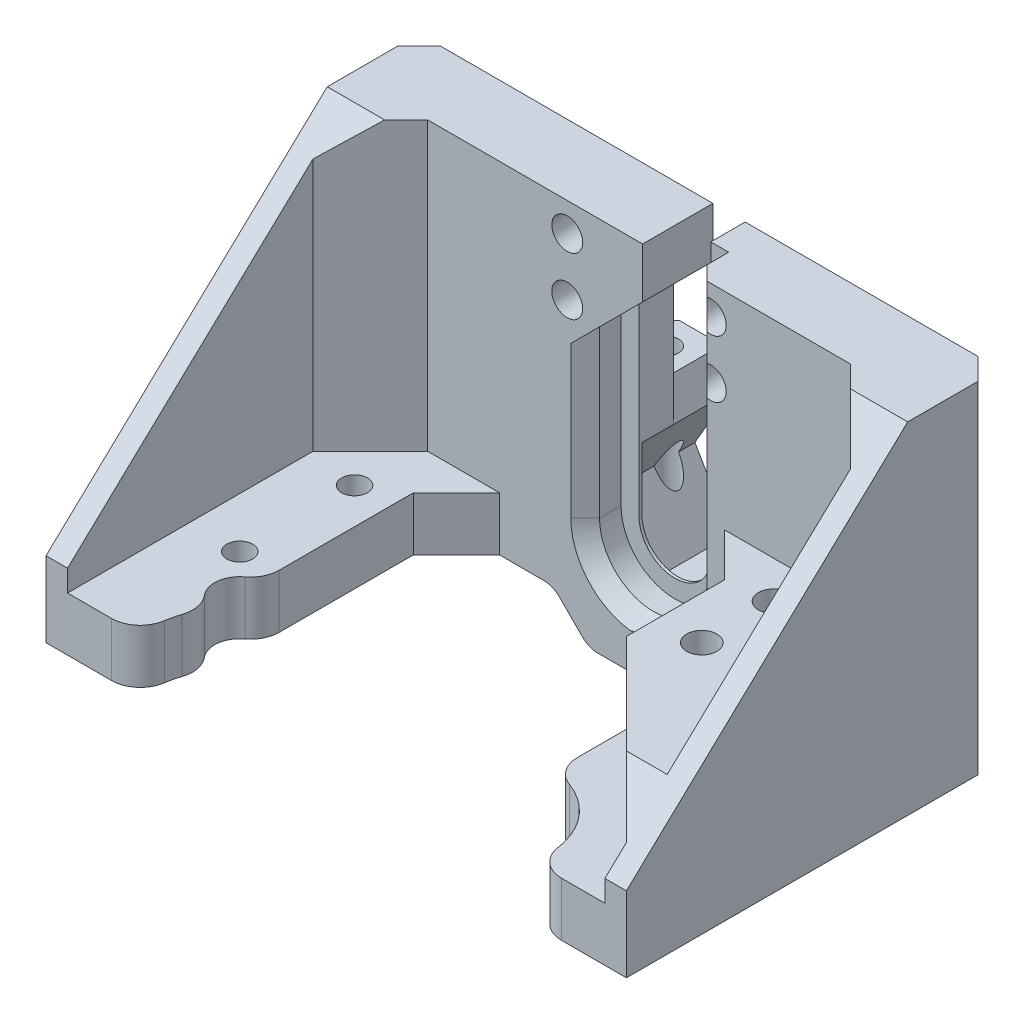
from build123d import *

# Parameters (mm, degrees)
SKETCH1_R                                            = 1
BOSS_EXTRUDE1_DEPTH                                  = 7.5
CSK_FOR_M3_HEX_SOCKET_COUNTERSUNK_HEAD_S_D           = 3.6
CSK_FOR_M3_HEX_SOCKET_COUNTERSUNK_HEAD_S_CSINK_D     = 6.94
CSK_FOR_M3_HEX_SOCKET_COUNTERSUNK_HEAD_S_CSINK_ANGLE = 90
SKETCH4_W                                            = 74.89
SKETCH4_H                                            = 9.8
BOSS_EXTRUDE2_DEPTH                                  = 40
BOSS_EXTRUDE3_DEPTH                                  = 3
BOSS_EXTRUDE4_START                                  = -74.89
BOSS_EXTRUDE4_DEPTH                                  = 3
SKETCH6_R                                            = 10.5
CUT_EXTRUDE1_DEPTH                                   = 92.491213239
FILLET1_R                                            = 4
BOSS_EXTRUDE5_START                                  = 5.2
SKETCH7_W                                            = 19.5
SKETCH7_H                                            = 19.2
BOSS_EXTRUDE5_DEPTH                                  = 6
SKETCH10_W                                           = 2.1
SKETCH10_H                                           = 34.8
F_4_2_4_2_DIAMETER_HOLE1_AT_2_COUNT                  = 2
F_4_2_4_2_DIAMETER_HOLE1_AT_2_PITCH                  = 10
CHAMFER1_SIZE                                        = 20
CHAMFER2_SIZE                                        = 8
CHAMFER3_SIZE                                        = 3
CHAMFER4_SIZE                                        = 6
CUT_EXTRUDE2_DEPTH                                   = 100.928184836
CUT_EXTRUDE3_DEPTH                                   = 5
BOSS_EXTRUDE6_DEPTH                                  = 9.8
BOSS_EXTRUDE8_DEPTH                                  = 8
CUT_EXTRUDE4_DEPTH                                   = 4.4
BOSS_EXTRUDE9_DEPTH                                  = 8
SKETCH17_R                                           = 1
CUT_EXTRUDE5_DEPTH                                   = 92.491213353
M3_CLEARANCE_HOLE1_D                                 = 3.4
CHAMFER9_SIZE                                        = 8
CHAMFER8_SIZE                                        = 2
F_4_3_4_3_DIAMETER_HOLE1_D                           = 4.3
SKETCH24_W                                           = 12
SKETCH24_H                                           = 5
BOSS_EXTRUDE10_DEPTH                                 = 17.8
CHAMFER10_SIZE                                       = 6
SKETCH25_R                                           = 3.75
CUT_EXTRUDE6_DEPTH                                   = 5
FILLET3_R                                            = 3


# Some blends are built 0.0001 mm under size
with BuildPart() as part:
    # Sketch1 → Boss-Extrude1 (new body)
    with BuildSketch(Plane(origin=(0, 0, 0), x_dir=(1, 0, 0), z_dir=(0, 1, 0))):
        Polygon((48.39, 9.2), (48.39, -33), (67.89, -33), (67.89, 19), (-7, 19), (-7, -33), (5, -33), (5, 9.2), align=None)
        with Locations(Location((0, 0, 0), (0, 0, 270))):
            Circle(SKETCH1_R, mode=Mode.SUBTRACT)
        with Locations(Location((0, -16, 0), (0, 0, 270))):
            Circle(SKETCH1_R, mode=Mode.SUBTRACT)
        with Locations(Location((54.39, 4, 0), (0, 0, 270))):
            Circle(SKETCH1_R, mode=Mode.SUBTRACT)
        with Locations(Location((54.39, -6, 0), (0, 0, 270))):
            Circle(SKETCH1_R, mode=Mode.SUBTRACT)
    extrude(amount=BOSS_EXTRUDE1_DEPTH)

    # CSK for M3 Hex Socket Countersunk Head Screw1 (through all)
    with Locations(Plane(origin=(0, 0, 0), x_dir=(-1, 0, 0), z_dir=(0, -1, 0))):
        with Locations((0, 0), (0, -16), (-54.39, 4), (-54.39, -6)):
            CounterSinkHole(CSK_FOR_M3_HEX_SOCKET_COUNTERSUNK_HEAD_S_D / 2, CSK_FOR_M3_HEX_SOCKET_COUNTERSUNK_HEAD_S_CSINK_D / 2, counter_sink_angle=CSK_FOR_M3_HEX_SOCKET_COUNTERSUNK_HEAD_S_CSINK_ANGLE)

    # Sketch4 → Boss-Extrude2 (add)
    with BuildSketch(Plane(origin=(0, 7.5, 0), x_dir=(1, 0, 0), z_dir=(0, 1, 0))):
        with Locations((30.445, 14.1)):
            Rectangle(SKETCH4_W, SKETCH4_H)
    extrude(amount=BOSS_EXTRUDE2_DEPTH)

    # Sketch5 → Boss-Extrude3 (add)
    with BuildSketch(Plane.ZY.offset(7)):
        Polygon((-19, 47.5), (-6.2, 47.5), (33, 10.5), (33, 0), (-19, 0), align=None)
    extrude(amount=BOSS_EXTRUDE3_DEPTH)

    # Sketch5<2> → Boss-Extrude4 (add)
    with BuildSketch(Plane.ZY.offset(7).offset(BOSS_EXTRUDE4_START)):
        Polygon((-19, 47.5), (-6.2, 47.5), (33, 10.5), (33, 0), (-19, 0), align=None)
    extrude(amount=-BOSS_EXTRUDE4_DEPTH)

    # Sketch6 → Cut-Extrude1 (cut, through all)
    with BuildSketch(Plane.XZ):
        with BuildLine():
            Line((3, 33), (3, 31))
            ThreePointArc((3, 31), (3.490813002, 27.827276305), (4.917366789, 24.951164809))
            ThreePointArc((4.917366789, 24.951164809), (4.958644749, 24.957880058), (5, 24.964101615))
            Line((5, 24.964101615), (5, 33))
            Line((5, 33), (3, 33))
        make_face()
        with BuildLine():
            ThreePointArc((5, 24.964101615), (4.958644749, 24.957880058), (4.917366789, 24.951164809))
            ThreePointArc((4.917366789, 24.951164809), (4.958487899, 24.893235633), (5, 24.835585997))
            Line((5, 24.835585997), (5, 24.964101615))
        make_face()
        with BuildLine():
            ThreePointArc((5, 24.835585997), (4.958487899, 24.893235633), (4.917366789, 24.951164809))
            ThreePointArc((4.917366789, 24.951164809), (2.000249852, 21.458180123), (5, 18.035898385))
            Line((5, 18.035898385), (5, 24.835585997))
        make_face()
        with Locations((47.5, 31)):
            Circle(SKETCH6_R)
    extrude(amount=-CUT_EXTRUDE1_DEPTH, mode=Mode.SUBTRACT)

    # Fillet1
    fillet1_edges = [part.edges().sort_by_distance(p)[0] for p in [
        (3, 3.75, 33),
        (4.917366789, 3.75, 24.951164809),
        (5, 3.75, 18.035898385),
        (57.807764064, 3.75, 33),
        (48.39, 3.75, 20.537787041),
    ]]
    fillet(fillet1_edges, radius=FILLET1_R)

    # Sketch7 → Boss-Extrude5 (add)
    with BuildSketch(Plane(origin=(0, 7.5, 0), x_dir=(1, 0, 0), z_dir=(0, 1, 0)).offset(BOSS_EXTRUDE5_START)):
        with Locations((58.14, -0.4)):
            Rectangle(SKETCH7_W, SKETCH7_H)
    extrude(amount=BOSS_EXTRUDE5_DEPTH)

    # Sketch10 → Ø4.2 (4.2) Diameter Hole1 (revolve, cut)
    with BuildSketch(Plane(origin=(54.39, 12.7, 6), x_dir=(0, 0, -1), z_dir=(1, 0, 0))):
        with Locations((1.05, 17.4)):
            Rectangle(SKETCH10_W, SKETCH10_H)
    f_4_2_4_2_diameter_hole1 = revolve(axis=Axis((54.39, 6.35, 6), (0, 1, 0)), mode=Mode.SUBTRACT)

    # Ø4.2 (4.2) Diameter Hole1 at 2: Ø4.2 (4.2) Diameter Hole1 ×2
    with Locations(*[(0, 0, -i * F_4_2_4_2_DIAMETER_HOLE1_AT_2_PITCH) for i in range(1, F_4_2_4_2_DIAMETER_HOLE1_AT_2_COUNT)]):
        add(f_4_2_4_2_diameter_hole1, mode=Mode.SUBTRACT)

    # Chamfer1
    # the kernel refuses this chamfer: 20 mm, written as the material it adds along each edge
    with BuildSketch(Plane(origin=(67.89, 12.7, 10), x_dir=(0.027495876610586317, 0, 0.9996219169112968), z_dir=(0, 1, 0))) as chamfer1_piece_1_section:
        Polygon((CHAMFER1_SIZE * 0.999621916911, -CHAMFER1_SIZE * 0.0274958766106), (-CHAMFER1_SIZE * 0.0274958766106, -CHAMFER1_SIZE * 0.999621916911), (0, 0), align=None)
    chamfer1_piece_1 = extrude(amount=6, mode=Mode.PRIVATE)
    chamfer1_piece_1 = split(chamfer1_piece_1, bisect_by=Plane(origin=(61.158483733, 21.28565178, 21.573039195), z_dir=(0, -0.7272189114449651, -0.6864056051904006)), keep=Keep.TOP, mode=Mode.PRIVATE)
    chamfer1_piece_1 = split(chamfer1_piece_1, bisect_by=Plane(origin=(48.39, 15.651248757, 16.254852669), z_dir=(1, 0, 0)), keep=Keep.TOP, mode=Mode.PRIVATE)
    add(chamfer1_piece_1)

    # Chamfer2
    chamfer2_edges = [part.edges().sort_by_distance(p)[0] for p in [
        (-7, 27.5, -9.2),
        (67.89, 33.1, -9.2),
    ]]
    chamfer(chamfer2_edges, length=CHAMFER2_SIZE)

    # Chamfer3
    chamfer3_edges = [part.edges().sort_by_distance(p)[0] for p in [
        (70.89, 23.75, -19),
        (-10, 23.75, -19),
    ]]
    chamfer(chamfer3_edges, length=CHAMFER3_SIZE)

    # Chamfer4
    chamfer4_edges = [part.edges().sort_by_distance(p)[0] for p in [
        (5, 3.75, -9.2),
        (48.39, 3.75, -9.2),
        (48.39, 15.7, -9.2),
    ]]
    chamfer(chamfer4_edges, length=CHAMFER4_SIZE)

    # Sketch11 → Cut-Extrude2 (cut, through all)
    with BuildSketch(Plane(origin=(0, 0, -19), x_dir=(-1, 0, 0), z_dir=(0, 0, -1))):
        with BuildLine():
            Line((-35.445, 9.4), (-35.445, 47.5))
            Line((-35.445, 47.5), (-25.445, 47.5))
            Line((-25.445, 47.5), (-25.445, 9.4))
            ThreePointArc((-25.445, 9.4), (-30.445, 4.4), (-35.445, 9.4))
        make_face()
    extrude(amount=-CUT_EXTRUDE2_DEPTH, mode=Mode.SUBTRACT)

    # Sketch14 → Cut-Extrude3 (cut)
    with BuildSketch(Plane.XY.offset(-9.2)):
        with BuildLine():
            Line((22.945, 9.4), (22.945, 47.5))
            Line((22.945, 47.5), (37.945, 47.5))
            Line((37.945, 47.5), (37.945, 9.4))
            ThreePointArc((37.945, 9.4), (30.445, 1.9), (22.945, 9.4))
        make_face()
    extrude(amount=-CUT_EXTRUDE3_DEPTH, mode=Mode.SUBTRACT)

    # Sketch12 → Boss-Extrude6 (add)
    with BuildSketch(Plane(origin=(0, 0, -9.2), x_dir=(-1, 0, 0), z_dir=(0, 0, -1))):
        Polygon((-22.945, 47.5), (-30.945, 47.5), (-30.945, 40.5), (-22.945, 32.5), align=None)
    extrude(amount=BOSS_EXTRUDE6_DEPTH)

    # Sketch15 → Boss-Extrude8 (add)
    with BuildSketch(Plane(origin=(0, 0, -19), x_dir=(-1, 0, 0), z_dir=(0, 0, -1))):
        with BuildLine():
            Line((-42.134311357, 0), (-18.755688643, 0))
            ThreePointArc((-18.755688643, 0), (-15.846445905, 12.847059375), (-24.195, 23.035890143))
            Line((-24.195, 23.035890143), (-25.445, 18.060254038))
            Line((-25.445, 18.060254038), (-20.445, 9.4))
            Line((-20.445, 9.4), (-25.445, 0.739745962))
            Line((-25.445, 0.739745962), (-35.445, 0.739745962))
            Line((-35.445, 0.739745962), (-40.445, 9.4))
            Line((-40.445, 9.4), (-35.445, 18.060254038))
            Line((-35.445, 18.060254038), (-36.695, 23.035890143))
            ThreePointArc((-36.695, 23.035890143), (-45.043554095, 12.847059375), (-42.134311357, 0))
        make_face()
    extrude(amount=BOSS_EXTRUDE8_DEPTH)

    # Sketch16 → Cut-Extrude4 (cut)
    with BuildSketch(Plane(origin=(0, 0, -19), x_dir=(-1, 0, 0), z_dir=(0, 0, -1))):
        with BuildLine():
            Line((-25.445, 0.739745962), (-20.445, 9.4))
            Line((-20.445, 9.4), (-25.445, 18.060254038))
            Line((-25.445, 18.060254038), (-25.445, 9.4))
            ThreePointArc((-25.445, 9.4), (-30.445, 4.4), (-35.445, 9.4))
            Line((-35.445, 9.4), (-35.445, 18.060254038))
            Line((-35.445, 18.060254038), (-40.445, 9.4))
            Line((-40.445, 9.4), (-35.445, 0.739745962))
            Line((-35.445, 0.739745962), (-25.445, 0.739745962))
        make_face()
    extrude(amount=-CUT_EXTRUDE4_DEPTH, mode=Mode.SUBTRACT)

    # Sketch18 → Boss-Extrude9 (add)
    with BuildSketch(Plane(origin=(0, 0, -19), x_dir=(-1, 0, 0), z_dir=(0, 0, -1))):
        with BuildLine():
            Line((-45.445, 9.4), (-45.445, 0))
            Line((-45.445, 0), (-42.134311357, 0))
            ThreePointArc((-42.134311357, 0), (-44.59313893, 4.41701246), (-45.445, 9.4))
        make_face()
        with BuildLine():
            Line((-18.755688643, 0), (-15.445, 0))
            Line((-15.445, 0), (-15.445, 9.4))
            ThreePointArc((-15.445, 9.4), (-16.29686107, 4.41701246), (-18.755688643, 0))
        make_face()
        with BuildLine():
            ThreePointArc((-24.195, 23.035890143), (-17.820618827, 17.500925873), (-15.445, 9.4))
            Line((-15.445, 9.4), (-15.445, 23.035890143))
            Line((-15.445, 23.035890143), (-24.195, 23.035890143))
        make_face()
        with BuildLine():
            Line((-45.445, 23.035890143), (-45.445, 9.4))
            ThreePointArc((-45.445, 9.4), (-43.069381173, 17.500925873), (-36.695, 23.035890143))
            Line((-36.695, 23.035890143), (-45.445, 23.035890143))
        make_face()
    extrude(amount=BOSS_EXTRUDE9_DEPTH)

    # Sketch17 → Cut-Extrude5 (cut, through all)
    with BuildSketch(Plane.XZ):
        with Locations(Location((20.445, -23, 0), (0, 0, 270))):
            Circle(SKETCH17_R)
        with Locations(Location((40.445, -23, 0), (0, 0, 90))):
            Circle(SKETCH17_R)
    extrude(amount=-CUT_EXTRUDE5_DEPTH, mode=Mode.SUBTRACT)

    # M3 Clearance Hole1 (through all)
    with Locations(Plane(origin=(0, 0, 0), x_dir=(-1, 0, 0), z_dir=(0, -1, 0))):
        with Locations((-20.445, 23), (-40.445, 23)):
            Hole(M3_CLEARANCE_HOLE1_D / 2)

    # Chamfer9
    chamfer9_edges = [part.edges().sort_by_distance(p)[0] for p in [
        (45.445, 11.517945072, -19),
        (15.445, 11.517945072, -19),
    ]]
    chamfer(chamfer9_edges, length=CHAMFER9_SIZE - 0.0001)  # a hair under: the kernel refuses the full size

    # Chamfer7
    # the kernel refuses this chamfer: 2 mm, written as the material it takes off along each edge
    with BuildSketch(Plane(origin=(57.08180896, 23.035890143, -15.36309104), x_dir=(-0.7068394360706733, 0.027495876610585647, 0.7068394360706738), z_dir=(-0.7071067811865477, 0, -0.7071067811865474))) as chamfer7_piece_1_section:
        with BuildLine():
            Line((2.05734639, 0), (-0.11309431, -2.054235587))
            Line((-0.11309431, -2.054235587), (-0.153079186, -2.053135752))
            ThreePointArc((-0.153079186, -2.053135752), (-0.068258454, -1.026795659), (-0.039984877, 0.001099835))
            Line((-0.039984877, 0.001099835), (0.001099835, 0.039984877))
            ThreePointArc((0.001099835, 0.039984877), (1.028995329, 0.011711299), (2.058446225, 0.039984877))
            Line((2.058446225, 0.039984877), (2.05734639, 0))
        make_face()
    chamfer7_piece_1 = extrude(amount=21.600299029, mode=Mode.PRIVATE)
    chamfer7_piece_1 = split(chamfer7_piece_1, bisect_by=Plane(origin=(49.014493998, 22.349128666, -19), z_dir=(0, 0, -1)), keep=Keep.TOP, mode=Mode.PRIVATE)
    add(chamfer7_piece_1, mode=Mode.SUBTRACT)
    with BuildSketch(Plane(origin=(57.08180896, 0, -15.36309104), x_dir=(-0.7068394360706733, -0.027495876610586473, 0.7068394360706738), z_dir=(-0.7071067811865477, 0, -0.7071067811865474))) as chamfer7_piece_2_section:
        with BuildLine():
            Line((2.05734639, 0), (-0.11309431, 2.054235587))
            Line((-0.11309431, 2.054235587), (-0.153079186, 2.053135752))
            ThreePointArc((-0.153079186, 2.053135752), (-0.068258454, 1.026795659), (-0.039984877, -0.001099835))
            Line((-0.039984877, -0.001099835), (0.001099835, -0.039984877))
            ThreePointArc((0.001099835, -0.039984877), (1.028995329, -0.011711299), (2.058446225, -0.039984877))
            Line((2.058446225, -0.039984877), (2.05734639, 0))
        make_face()
    chamfer7_piece_2 = extrude(amount=21.600299029, mode=Mode.PRIVATE)
    chamfer7_piece_2 = split(chamfer7_piece_2, bisect_by=Plane(origin=(49.014493998, 0.686761477, -19), z_dir=(0, 0, -1)), keep=Keep.TOP, mode=Mode.PRIVATE)
    add(chamfer7_piece_2, mode=Mode.SUBTRACT)
    with BuildSketch(Plane(origin=(19.08190896, 23.035890143, -30.63680896), x_dir=(0.7068394360706736, 0.0274958766105856, 0.7068394360706736), z_dir=(-0.7071067811865476, 0, 0.7071067811865476))) as chamfer7_piece_3_section:
        with BuildLine():
            Line((2.05734639, 0), (-0.11309431, -2.054235587))
            Line((-0.11309431, -2.054235587), (-0.153079186, -2.053135752))
            ThreePointArc((-0.153079186, -2.053135752), (-0.068258454, -1.026795659), (-0.039984877, 0.001099835))
            Line((-0.039984877, 0.001099835), (0.001099835, 0.039984877))
            ThreePointArc((0.001099835, 0.039984877), (1.028995329, 0.011711299), (2.058446225, 0.039984877))
            Line((2.058446225, 0.039984877), (2.05734639, 0))
        make_face()
    chamfer7_piece_3 = extrude(amount=21.600299029, mode=Mode.PRIVATE)
    chamfer7_piece_3 = split(chamfer7_piece_3, bisect_by=Plane(origin=(17.51212973, 22.399703893, -19), z_dir=(0, 0, -1)), keep=Keep.TOP, mode=Mode.PRIVATE)
    add(chamfer7_piece_3, mode=Mode.SUBTRACT)
    with BuildSketch(Plane(origin=(19.08190896, 0, -30.63680896), x_dir=(0.7068394360706735, -0.02749587661058643, 0.7068394360706735), z_dir=(-0.7071067811865476, 0, 0.7071067811865476))) as chamfer7_piece_4_section:
        with BuildLine():
            Line((2.05734639, 0), (-0.11309431, 2.054235587))
            Line((-0.11309431, 2.054235587), (-0.153079186, 2.053135752))
            ThreePointArc((-0.153079186, 2.053135752), (-0.068258454, 1.026795659), (-0.039984877, -0.001099835))
            Line((-0.039984877, -0.001099835), (0.001099835, -0.039984877))
            ThreePointArc((0.001099835, -0.039984877), (1.028995329, -0.011711299), (2.058446225, -0.039984877))
            Line((2.058446225, -0.039984877), (2.05734639, 0))
        make_face()
    chamfer7_piece_4 = extrude(amount=21.600299029, mode=Mode.PRIVATE)
    chamfer7_piece_4 = split(chamfer7_piece_4, bisect_by=Plane(origin=(17.51212973, 0.63618625, -19), z_dir=(0, 0, -1)), keep=Keep.TOP, mode=Mode.PRIVATE)
    add(chamfer7_piece_4, mode=Mode.SUBTRACT)

    # Chamfer8
    # the kernel refuses this chamfer: 2 mm, written as the material it takes off along each edge
    with BuildSketch(Plane(origin=(30.445, 9.4, -9.2), x_dir=(1, 0, 0), z_dir=(0, 1, 0))) as chamfer8_piece_1:
        Polygon((7.5, CHAMFER8_SIZE), (7.5 + CHAMFER8_SIZE, 0), (7.5, 0), align=None)
    revolve(axis=Axis((30.445, 9.4, -9.2), (0, 0, -1)), revolution_arc=180, mode=Mode.SUBTRACT)
    with BuildSketch(Plane(origin=(37.945, 52.643365976, -9.2), x_dir=(-0.027495876610585623, 0, -0.9996219169112968), z_dir=(0, -1, 0))) as chamfer8_piece_2:
        Polygon((CHAMFER8_SIZE * 0.999621916911, CHAMFER8_SIZE * 0.0274958766106), (-CHAMFER8_SIZE * 0.0274958766106, CHAMFER8_SIZE * 0.999621916911), (0, 0), align=None)
    extrude(amount=43.243365976, mode=Mode.SUBTRACT)
    with BuildSketch(Plane(origin=(22.945, 9.4, -9.2), x_dir=(0.027495876610585623, 0, -0.9996219169112968), z_dir=(0, 1, 0))) as chamfer8_piece_3_section:
        Polygon((CHAMFER8_SIZE * 0.999621916911, CHAMFER8_SIZE * 0.0274958766106), (-CHAMFER8_SIZE * 0.0274958766106, CHAMFER8_SIZE * 0.999621916911), (0, 0), align=None)
    chamfer8_piece_3 = extrude(amount=28.243365976, mode=Mode.PRIVATE)
    chamfer8_piece_3 = split(chamfer8_piece_3, bisect_by=Plane(origin=(16.683799048, 26.238799048, -9.86563861), z_dir=(0.7071067811865517, -0.7071067811865435, 0)), keep=Keep.TOP, mode=Mode.PRIVATE)
    add(chamfer8_piece_3, mode=Mode.SUBTRACT)

    # Ø4.3 (4.3) Diameter Hole1 (through all)
    with Locations(Plane(origin=(0, 0, -19), x_dir=(-1, 0, 0), z_dir=(0, 0, -1))):
        with Locations((-20.445, 43.5), (-40.445, 43.5), (-40.445, 35.5), (-20.445, 35.5)):
            Hole(F_4_3_4_3_DIAMETER_HOLE1_D / 2)

    # Sketch24 → Boss-Extrude10 (add)
    with BuildSketch(Plane(origin=(0, 0, -27), x_dir=(-1, 0, 0), z_dir=(0, 0, -1))):
        with Locations((-30.445, -2.5)):
            Rectangle(SKETCH24_W, SKETCH24_H)
    extrude(amount=-BOSS_EXTRUDE10_DEPTH)

    # Chamfer10
    # the kernel refuses this chamfer: 6 mm, written as the material it adds along each edge
    with BuildSketch(Plane(origin=(24.445, 0, -27), x_dir=(-0.9996219169112969, 0.027495876610586382, 0), z_dir=(0, 0, 1))) as chamfer10_piece_1_section:
        Polygon((CHAMFER10_SIZE * 0.999621916911, CHAMFER10_SIZE * 0.0274958766106), (-CHAMFER10_SIZE * 0.0274958766106, CHAMFER10_SIZE * 0.999621916911), (0, 0), align=None)
    chamfer10_piece_1 = extrude(amount=17.8, mode=Mode.PRIVATE)
    chamfer10_piece_1 = split(chamfer10_piece_1, bisect_by=Plane(origin=(22.4928011, -5, -17.799111782), z_dir=(0, 1, 0)), keep=Keep.TOP, mode=Mode.PRIVATE)
    chamfer10_piece_1 = chamfer10_piece_1 - Plane(origin=(20.445, -1.885016642, -23), x_dir=(1, 0, 0), z_dir=(0, 1, 0)) * Cylinder(1.7, 60, mode=Mode.PRIVATE)
    add(chamfer10_piece_1)
    with BuildSketch(Plane(origin=(36.445, 0, -27), x_dir=(0.9996219169112968, 0.027495876610586115, 0), z_dir=(0, 0, 1))) as chamfer10_piece_2_section:
        Polygon((CHAMFER10_SIZE * 0.999621916911, -CHAMFER10_SIZE * 0.0274958766106), (-CHAMFER10_SIZE * 0.0274958766106, -CHAMFER10_SIZE * 0.999621916911), (0, 0), align=None)
    chamfer10_piece_2 = extrude(amount=17.8, mode=Mode.PRIVATE)
    chamfer10_piece_2 = split(chamfer10_piece_2, bisect_by=Plane(origin=(35.20353905, -1.820831898, -16.38646095), z_dir=(0.7071067811865476, 0, -0.7071067811865476)), keep=Keep.TOP, mode=Mode.PRIVATE)
    chamfer10_piece_2 = chamfer10_piece_2 - Plane(origin=(40.445, -1.820831898, -23), x_dir=(1, 0, 0), z_dir=(0, 1, 0)) * Cylinder(1.7, 60, mode=Mode.PRIVATE)
    chamfer10_piece_2 = split(chamfer10_piece_2, bisect_by=Plane(origin=(38.540643339, -5, -19.723565238), z_dir=(0, 1, 0)), keep=Keep.TOP, mode=Mode.PRIVATE)
    add(chamfer10_piece_2)
    with BuildSketch(Plane(origin=(36.445, 0, -27), x_dir=(0.9996219169112968, 0.027495876610586115, 0), z_dir=(0, 0, 1))) as chamfer10_piece_3_section:
        Polygon((CHAMFER10_SIZE * 0.999621916911, -CHAMFER10_SIZE * 0.0274958766106), (-CHAMFER10_SIZE * 0.0274958766106, -CHAMFER10_SIZE * 0.999621916911), (0, 0), align=None)
    chamfer10_piece_3 = extrude(amount=17.8, mode=Mode.PRIVATE)
    chamfer10_piece_3 = split(chamfer10_piece_3, bisect_by=Plane(origin=(39.039551122, -2.097320223, -12.550448878), z_dir=(-0.7071067811865476, 0, 0.7071067811865476)), keep=Keep.TOP, mode=Mode.PRIVATE)
    chamfer10_piece_3 = split(chamfer10_piece_3, bisect_by=Plane(origin=(37.922734829, -5, -11.433632585), z_dir=(0, 1, 0)), keep=Keep.TOP, mode=Mode.PRIVATE)
    add(chamfer10_piece_3)
    with BuildSketch(Plane(origin=(36.445, 0, -27), x_dir=(0.9996219169112968, 0.027495876610586115, 0), z_dir=(0, 0, 1))) as chamfer10_piece_4_section:
        Polygon((CHAMFER10_SIZE * 0.999621916911, -CHAMFER10_SIZE * 0.0274958766106), (-CHAMFER10_SIZE * 0.0274958766106, -CHAMFER10_SIZE * 0.999621916911), (0, 0), align=None)
    chamfer10_piece_4 = extrude(amount=33.230097928, mode=Mode.PRIVATE)
    chamfer10_piece_4 = split(chamfer10_piece_4, bisect_by=Plane(origin=(42.492111727, 0.181816824, -9.097888273), z_dir=(0.7071067811865476, 0, -0.7071067811865476)), keep=Keep.TOP, mode=Mode.PRIVATE)
    chamfer10_piece_4 = split(chamfer10_piece_4, bisect_by=Plane(origin=(42.526148969, 0.181816824, -9.2), z_dir=(0, 0, 1)), keep=Keep.TOP, mode=Mode.PRIVATE)
    add(chamfer10_piece_4)

    # Sketch25 → Cut-Extrude6 (cut)
    with BuildSketch(Plane.XZ.offset(5)):
        with Locations((40.445, -23)):
            Circle(SKETCH25_R)
        with Locations((20.445, -23)):
            Circle(SKETCH25_R)
    extrude(amount=-CUT_EXTRUDE6_DEPTH, mode=Mode.SUBTRACT)

    # Fillet3
    # the kernel refuses this fillet: 3 mm, written as the material it adds along each edge
    with BuildSketch(Plane(origin=(42.445, 0, -22.934457333), x_dir=(-0.7071067811862632, -0.7071067811868319, 0), z_dir=(0, 0, 1))) as fillet3_piece_1_section:
        with BuildLine():
            CenterArc((FILLET3_R * 0.414213562373, FILLET3_R), FILLET3_R, 225, 45)
            Line((-FILLET3_R * 0.292893218813, FILLET3_R * 0.292893218814), (0, 0))
            Line((0, 0), (FILLET3_R * 0.414213562373, 0))
        make_face()
    fillet3_piece_1 = extrude(amount=16.89605905, mode=Mode.PRIVATE)
    fillet3_piece_1 = split(fillet3_piece_1, bisect_by=Plane(origin=(39.748763277, -0.175443117, -11.841236723), z_dir=(0.7071067811865476, 0, -0.7071067811865476)), keep=Keep.TOP, mode=Mode.PRIVATE)
    fillet3_piece_1 = fillet3_piece_1 - Plane(origin=(40.445, -0.175443117, -23), x_dir=(1, 0, 0), z_dir=(0, -1, 0)) * Cylinder(3.75, 39, mode=Mode.PRIVATE)
    fillet3_piece_1 = split(fillet3_piece_1, bisect_by=Plane(origin=(42.545702362, -0.175443117, -9.2), z_dir=(0, 0, -1)), keep=Keep.TOP, mode=Mode.PRIVATE)
    add(fillet3_piece_1)
    with BuildSketch(Plane(origin=(42.445, 0, -22.934457333), x_dir=(-0.7071067811862632, -0.7071067811868319, 0), z_dir=(0, 0, 1))) as fillet3_piece_2_section:
        with BuildLine():
            CenterArc((FILLET3_R * 0.414213562373, FILLET3_R), FILLET3_R, 225, 45)
            Line((-FILLET3_R * 0.292893218813, FILLET3_R * 0.292893218814), (0, 0))
            Line((0, 0), (FILLET3_R * 0.414213562373, 0))
        make_face()
    fillet3_piece_2 = extrude(amount=16.89605905, mode=Mode.PRIVATE)
    fillet3_piece_2 = split(fillet3_piece_2, bisect_by=Plane(origin=(42.922925552, -0.008986559, -8.667074448), z_dir=(0.7071067811865476, 0, -0.7071067811865476)), keep=Keep.TOP, mode=Mode.PRIVATE)
    fillet3_piece_2 = split(fillet3_piece_2, bisect_by=Plane(origin=(43.100567402, -0.008986559, -9.2), z_dir=(0, 0, 1)), keep=Keep.TOP, mode=Mode.PRIVATE)
    add(fillet3_piece_2)
    with BuildSketch(Plane(origin=(42.445, 0, -22.934457333), x_dir=(-0.7071067811862632, -0.7071067811868319, 0), z_dir=(0, 0, 1))) as fillet3_piece_3_section:
        with BuildLine():
            CenterArc((FILLET3_R * 0.414213562373, FILLET3_R), FILLET3_R, 225, 45)
            Line((-FILLET3_R * 0.292893218813, FILLET3_R * 0.292893218814), (0, 0))
            Line((0, 0), (FILLET3_R * 0.414213562373, 0))
        make_face()
    fillet3_piece_3 = extrude(amount=16.89605905, mode=Mode.PRIVATE)
    fillet3_piece_3 = split(fillet3_piece_3, bisect_by=Plane(origin=(42.023275547, -0.531665064, -9.566724453), z_dir=(-0.7071067811865476, 0, 0.7071067811865476)), keep=Keep.TOP, mode=Mode.PRIVATE)
    fillet3_piece_3 = split(fillet3_piece_3, bisect_by=Plane(origin=(41.901034062, -0.531665064, -9.2), z_dir=(0, 0, -1)), keep=Keep.TOP, mode=Mode.PRIVATE)
    add(fillet3_piece_3)
    with BuildSketch(Plane(origin=(18.445, 0, -22.934457333), x_dir=(-1, 0, 0), z_dir=(0, 0, 1))) as fillet3_piece_4_section:
        with BuildLine():
            CenterArc((FILLET3_R * 0.414213562373, FILLET3_R), FILLET3_R, 225, 45)
            Line((-FILLET3_R * 0.292893218814, FILLET3_R * 0.292893218814), (0, 0))
            Line((0, 0), (FILLET3_R * 0.414213562373, 0))
        make_face()
    fillet3_piece_4 = extrude(amount=13.734457333, mode=Mode.PRIVATE)
    fillet3_piece_4 = fillet3_piece_4 - Plane(origin=(20.445, -0.179809013, -23), x_dir=(1, 0, 0), z_dir=(0, -1, 0)) * Cylinder(3.75, 33, mode=Mode.PRIVATE)
    add(fillet3_piece_4)
    # the kernel refuses this fillet: 3 mm, written as the material it takes off along each edge
    with BuildSketch(Plane(origin=(23.445, -5, -23.856601718), x_dir=(-0.7071067811862651, 0.7071067811868298, 0), z_dir=(0, 0, 1)), Plane(origin=(37.445, -5, -6.093398282), x_dir=(0.7071067811862664, 0.7071067811868288, 0), z_dir=(0, 0, -1))) as fillet3_2_piece_1:
        with BuildLine():
            CenterArc((FILLET3_R * 0.414213562373, -FILLET3_R), FILLET3_R, 90, 45)
            Line((-FILLET3_R * 0.292893218814, -FILLET3_R * 0.292893218814), (0, 0))
            Line((0, 0), (FILLET3_R * 0.414213562373, 0))
        make_face()
    extrude(amount=17.763203436, mode=Mode.SUBTRACT)
    with BuildSketch(Plane(origin=(37.445, -5, -22.143398282), x_dir=(0.7071067811862664, 0.7071067811868288, 0), z_dir=(0, 0, -1)), Plane(origin=(23.445, -5, -30.106601718), x_dir=(-0.7071067811862651, 0.7071067811868298, 0), z_dir=(0, 0, 1))) as fillet3_2_piece_2:
        with BuildLine():
            CenterArc((FILLET3_R * 0.414213562373, -FILLET3_R), FILLET3_R, 90, 45)
            Line((-FILLET3_R * 0.292893218814, -FILLET3_R * 0.292893218814), (0, 0))
            Line((0, 0), (FILLET3_R * 0.414213562373, 0))
        make_face()
    extrude(amount=7.963203436, mode=Mode.SUBTRACT)


solid = part.part
